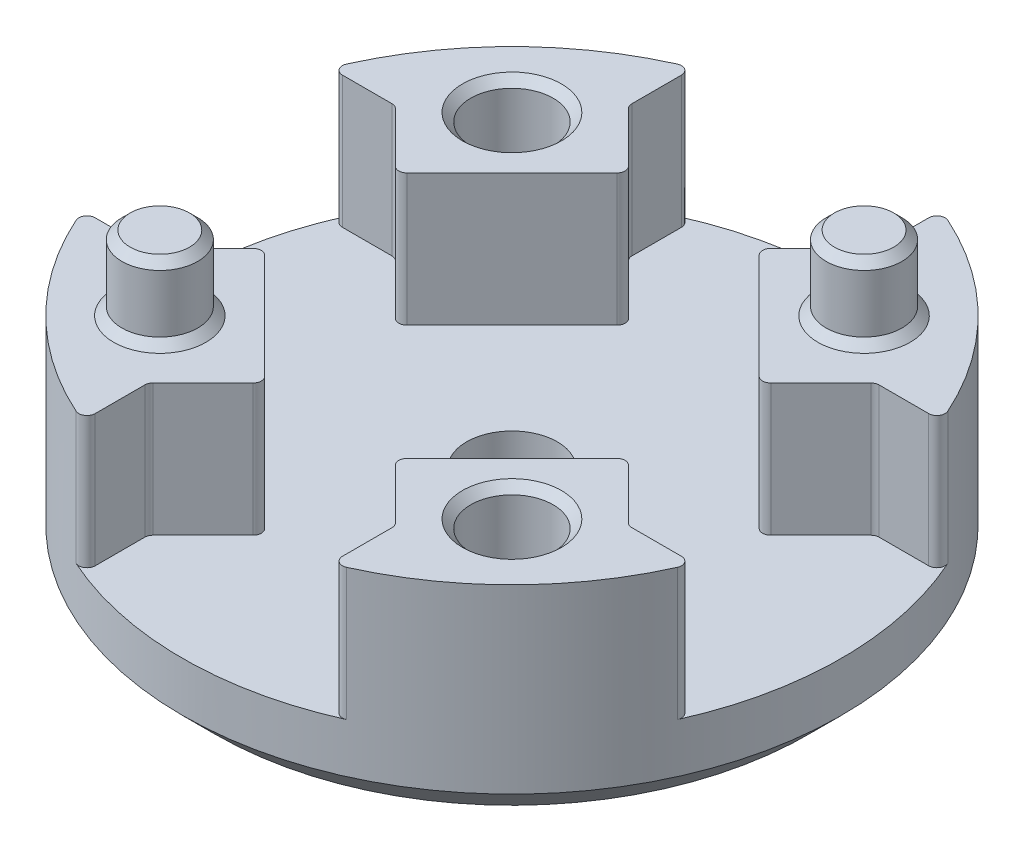
from build123d import *

# Parameters (mm, degrees)
SKETCH_1_R               = 20
EXTRUDE_1_DEPTH          = 5
EXTRUDE_2_DEPTH          = 8
FILLET_1_R               = 0.5
PATTERN_START            = 5
PATTERN_CIRCULAR_1_DEPTH = 8
SKETCH_3_R               = 2.5000000000000004
CUT_EXTRUDE_1_DEPTH      = 5
EXTRUDE_START            = 4.5
SKETCH_3_3_R             = 2.5000000000000004
SKETCH_3_3_R_2           = 2.2999999999999994
EXTRUDE_3_DEPTH          = 4.5
CHAMFER_1_SIZE           = 0.5
SKETCH_4_R               = 2.75
CUT_EXTRUDE_2_DEPTH      = 34.26033673912518
CHAMFER_2_SIZE           = 2


# Read off the part's stored shape, not the designer's step: 阵列(圆周)1
with BuildPart() as part:
    # 草图1 → 凸台-拉伸1 (new body)
    with BuildSketch(Plane(origin=(0, 0, 0), x_dir=(1, 0, 0), z_dir=(0, 1, 0))):
        with Locations(Location((0, 0, 0), (0, 0, 270))):
            Circle(SKETCH_1_R)
    extrude(amount=EXTRUDE_1_DEPTH)

    # 草图2 → 凸台-拉伸2 (add)
    with BuildSketch(Plane(origin=(0, 5, 0), x_dir=(1, 0, 0), z_dir=(0, 1, 0))):
        with BuildLine():
            Line((14.57106781186547, -7.500000000000001), (11.035533905932741, -3.9644660940672627))
            Line((11.035533905932741, -3.9644660940672627), (3.9644660940672627, -11.03553390593274))
            Line((3.9644660940672627, -11.03553390593274), (7.500000000000001, -14.571067811865477))
            Line((7.500000000000001, -14.571067811865477), (7.500000000000001, -18.540496217739157))
            ThreePointArc((7.500000000000001, -18.540496217739157), (14.142135623730951, -14.14213562373095), (18.540496217739157, -7.500000000000001))
            Line((18.540496217739157, -7.500000000000001), (14.57106781186547, -7.500000000000001))
        make_face()
    extrude(amount=EXTRUDE_2_DEPTH)

    # 圆角1
    fillet_1_edges = [part.edges().sort_by_distance(p)[0] for p in [
        (7.500000000000001, 9, 14.571067811865477),
        (7.500000000000001, 9, 18.540496217739157),
        (18.540496217739154, 9, 7.500000000000002),
        (14.57106781186547, 9, 7.500000000000001),
        (11.035533905932741, 9, 3.9644660940672627),
        (3.9644660940672627, 9, 11.03553390593274),
    ]]
    fillet(fillet_1_edges, radius=FILLET_1_R)

    # 阵列(圆周)1 outline → 阵列(圆周)1 (add)
    with BuildSketch(Plane(origin=(0, 0, 0), x_dir=(1, 0, 0), z_dir=(0, 1, 0)).offset(PATTERN_START)):
        with BuildLine():
            ThreePointArc((17.783419244, 7.5), (18.203278805, 7.728489505), (18.239404353, 8.205128205))
            ThreePointArc((18.239404353, 8.205128205), (14.142135624, 14.142135624), (8.205128205, 18.239404353))
            ThreePointArc((8.205128205, 18.239404353), (7.728489505, 18.203278805), (7.5, 17.783419244))
            Line((7.5, 17.783419244), (7.5, 14.778174593))
            ThreePointArc((7.5, 14.778174593), (7.461939766, 14.586832877), (7.353553391, 14.424621202))
            Line((7.353553391, 14.424621202), (4.318019485, 11.389087297))
            ThreePointArc((4.318019485, 11.389087297), (4.171572875, 11.035533906), (4.318019485, 10.681980515))
            Line((4.318019485, 10.681980515), (10.681980515, 4.318019485))
            ThreePointArc((10.681980515, 4.318019485), (11.035533906, 4.171572875), (11.389087297, 4.318019485))
            Line((11.389087297, 4.318019485), (14.424621202, 7.353553391))
            ThreePointArc((14.424621202, 7.353553391), (14.586832877, 7.461939766), (14.778174593, 7.5))
            Line((14.778174593, 7.5), (17.783419244, 7.5))
        make_face()
        with BuildLine():
            ThreePointArc((-18.239404353, -8.205128205), (-14.142135624, -14.142135624), (-8.205128205, -18.239404353))
            ThreePointArc((-8.205128205, -18.239404353), (-7.728489505, -18.203278805), (-7.5, -17.783419244))
            Line((-7.5, -17.783419244), (-7.5, -14.778174593))
            ThreePointArc((-7.5, -14.778174593), (-7.461939766, -14.586832877), (-7.353553391, -14.424621202))
            Line((-7.353553391, -14.424621202), (-4.318019485, -11.389087297))
            ThreePointArc((-4.318019485, -11.389087297), (-4.171572875, -11.035533906), (-4.318019485, -10.681980515))
            Line((-4.318019485, -10.681980515), (-10.681980515, -4.318019485))
            ThreePointArc((-10.681980515, -4.318019485), (-11.035533906, -4.171572875), (-11.389087297, -4.318019485))
            Line((-11.389087297, -4.318019485), (-14.424621202, -7.353553391))
            ThreePointArc((-14.424621202, -7.353553391), (-14.586832877, -7.461939766), (-14.778174593, -7.5))
            Line((-14.778174593, -7.5), (-17.783419244, -7.5))
            ThreePointArc((-17.783419244, -7.5), (-18.203278805, -7.728489505), (-18.239404353, -8.205128205))
        make_face()
        with BuildLine():
            ThreePointArc((-7.5, 17.783419244), (-7.728489505, 18.203278805), (-8.205128205, 18.239404353))
            ThreePointArc((-8.205128205, 18.239404353), (-14.142135624, 14.142135624), (-18.239404353, 8.205128205))
            ThreePointArc((-18.239404353, 8.205128205), (-18.203278805, 7.728489505), (-17.783419244, 7.5))
            Line((-17.783419244, 7.5), (-14.778174593, 7.5))
            ThreePointArc((-14.778174593, 7.5), (-14.586832877, 7.461939766), (-14.424621202, 7.353553391))
            Line((-14.424621202, 7.353553391), (-11.389087297, 4.318019485))
            ThreePointArc((-11.389087297, 4.318019485), (-11.035533906, 4.171572875), (-10.681980515, 4.318019485))
            Line((-10.681980515, 4.318019485), (-4.318019485, 10.681980515))
            ThreePointArc((-4.318019485, 10.681980515), (-4.171572875, 11.035533906), (-4.318019485, 11.389087297))
            Line((-4.318019485, 11.389087297), (-7.353553391, 14.424621202))
            ThreePointArc((-7.353553391, 14.424621202), (-7.461939766, 14.586832877), (-7.5, 14.778174593))
            Line((-7.5, 14.778174593), (-7.5, 17.783419244))
        make_face()
    extrude(amount=PATTERN_CIRCULAR_1_DEPTH)

    # 草图3 → 切除-拉伸1 (cut)
    with BuildSketch(Plane(origin=(0, 13.000000000000002, 0), x_dir=(1, 0, 0), z_dir=(0, 1, 0))):
        with Locations(Location((-10.681980515339466, 10.681980515339463, 0), (0, 0, 270))):
            Circle(SKETCH_3_R)
        with Locations(Location((10.681980515339466, -10.681980515339463, 0), (0, 0, 270))):
            Circle(SKETCH_3_R)
    extrude(amount=-CUT_EXTRUDE_1_DEPTH, mode=Mode.SUBTRACT)

    # 草图3<3> → 凸台-拉伸3 (add)
    with BuildSketch(Plane(origin=(0, 13.000000000000002, 0), x_dir=(1, 0, 0), z_dir=(0, 1, 0)).offset(EXTRUDE_START)):
        with Locations(Location((10.681980515339466, -10.681980515339463, 0), (0, 0, 270))):
            Circle(SKETCH_3_3_R)
        with Locations(Location((-10.681980515339466, 10.681980515339463, 0), (0, 0, 270))):
            Circle(SKETCH_3_3_R)
        with Locations(Location((10.681980515339466, 10.681980515339463, 0), (0, 0, 270))):
            Circle(SKETCH_3_3_R_2)
        with Locations(Location((-10.681980515339465, -10.681980515339465, 0), (0, 0, 270))):
            Circle(SKETCH_3_3_R_2)
    extrude(amount=-EXTRUDE_3_DEPTH)


with BuildPart() as extrude_3_kept_piece:
    # of the separate pieces the step leaves, the one the design keeps (extrude_3_pieces_kept)
    add(part.part.solids().sort_by_distance((8.205128205, 5, 18.239404353))[0])

    # 倒角1
    chamfer_1_edges = [extrude_3_kept_piece.edges().sort_by_distance(p)[0] for p in [
        (-10.681980515339466, 8.000000000000002, -13.181980515339463),
        (-10.681980515339466, 13.000000000000002, -13.181980515339463),
        (10.681980515339466, 8.000000000000002, 8.181980515339463),
        (10.681980515339466, 13.000000000000002, 8.181980515339463),
        (10.681980515339466, 13.000000000000002, -12.981980515339462),
        (10.681980515339466, 17.5, -12.981980515339462),
        (-10.681980515339465, 13.000000000000002, 8.381980515339466),
        (-10.681980515339465, 17.5, 8.381980515339466),
    ]]
    chamfer(chamfer_1_edges, length=CHAMFER_1_SIZE)

    # 草图4 → 切除-拉伸2 (cut, through all)
    with BuildSketch(Plane.XZ):
        with Locations(Location((0, 0, 0), (0, 0, 270))):
            Circle(SKETCH_4_R)
    extrude(amount=-CUT_EXTRUDE_2_DEPTH, mode=Mode.SUBTRACT)

    # 倒角2
    chamfer_2_edges = [extrude_3_kept_piece.edges().sort_by_distance(p)[0] for p in [
        (6.12e-15, 0, -20),
    ]]
    chamfer(chamfer_2_edges, length=CHAMFER_2_SIZE)


solid = extrude_3_kept_piece.part
